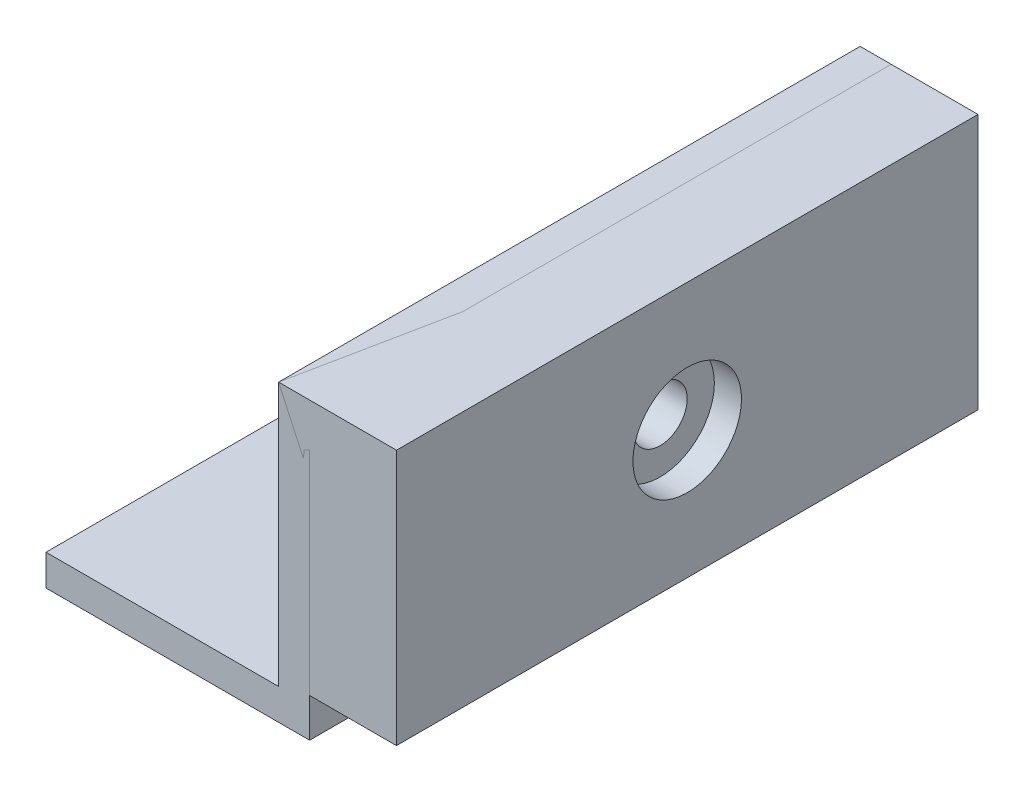
from build123d import *

# Parameters (mm, degrees)
SKETCH1_W           = 75
SKETCH1_H           = 33
SKETCH1_R           = 3.5
BOSS_EXTRUDE1_DEPTH = 11.2
SKETCH2_R           = 7
CUT_EXTRUDE1_DEPTH  = 3.5
BOSS_EXTRUDE2_START = 4
SKETCH3_W           = 75
SKETCH3_H           = 33
SKETCH3_R           = 3.5
BOSS_EXTRUDE2_DEPTH = 4
SKETCH3_3_W         = 75
SKETCH3_3_H         = 38
SKETCH3_3_R         = 3.5
BOSS_EXTRUDE4_DEPTH = 4
SKETCH6_W           = 75
SKETCH6_H           = 4.002033335
BOSS_EXTRUDE6_DEPTH = 30


with BuildPart() as part:
    # Sketch1 → Boss-Extrude1 (new body)
    with BuildSketch(Plane(origin=(0, 0, 0), x_dir=(0, 0, -1), z_dir=(1, 0, 0))):
        Rectangle(SKETCH1_W, SKETCH1_H)
        Circle(SKETCH1_R, mode=Mode.SUBTRACT)
    extrude(amount=BOSS_EXTRUDE1_DEPTH)

    # Sketch2 → Cut-Extrude1 (cut)
    with BuildSketch(Plane(origin=(11.2, 0, 0), x_dir=(0, 0, -1), z_dir=(1, 0, 0))):
        Circle(SKETCH2_R)
    extrude(amount=-CUT_EXTRUDE1_DEPTH, mode=Mode.SUBTRACT)

    # Sketch3 → Boss-Extrude2 (add)
    with BuildSketch(Plane.ZY.offset(BOSS_EXTRUDE2_START)):
        Rectangle(SKETCH3_W, SKETCH3_H)
        Circle(SKETCH3_R, mode=Mode.SUBTRACT)
    extrude(amount=-BOSS_EXTRUDE2_DEPTH)


with BuildPart() as body_2:
    # Sketch3<3> → Boss-Extrude4 (new body)
    with BuildSketch(Plane.ZY):
        with Locations((0, -2.5)):
            Rectangle(SKETCH3_3_W, SKETCH3_3_H)
        Circle(SKETCH3_3_R, mode=Mode.SUBTRACT)
    extrude(amount=BOSS_EXTRUDE4_DEPTH)

    # Sketch6 → Boss-Extrude6 (add)
    with BuildSketch(Plane.ZY.offset(4)):
        with Locations((0, -19.498983332)):
            Rectangle(SKETCH6_W, SKETCH6_H)
    extrude(amount=BOSS_EXTRUDE6_DEPTH)


solid = Compound([part.part, body_2.part])
